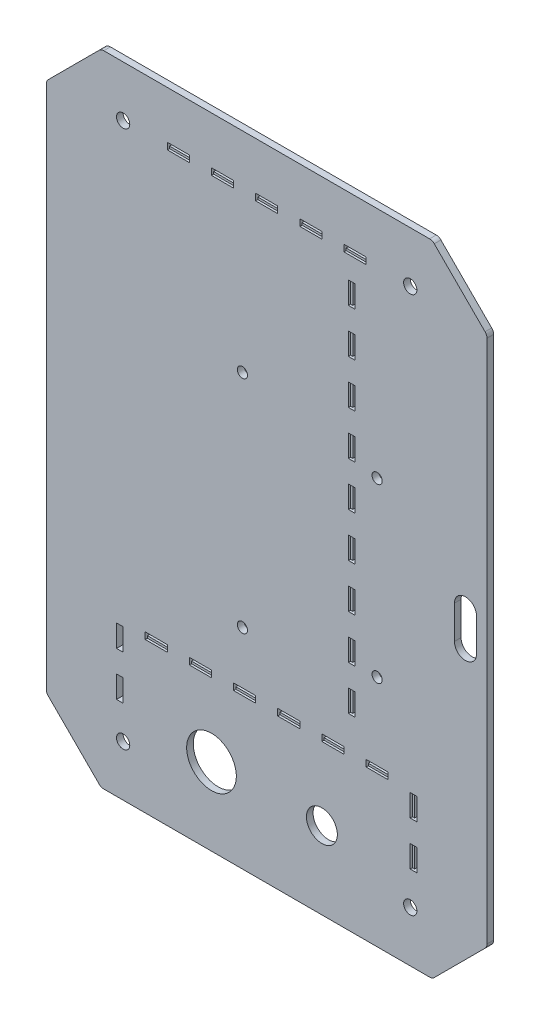
from build123d import *

# Parameters (mm, degrees)
BASE_DEPTH                             = 3
ESQUISSE2_R                            = 3
PER_AGE_PROFIL_DEPTH                   = 5
ESQUISSE3_R                            = 2.3
PER_AGE_LIDAR_DEPTH                    = 176.815265444
ESQUISSE4_R                            = 11.25
PER_AGE_BOUTON_D_ARRET_D_URGENCE_DEPTH = 176.815265444
ESQUISSE5_R                            = 7
PER_AGE_TIRETTE_DEPTH                  = 176.815265444
PER_AGE_CABLE_MANAGEMENT_DEPTH         = 176.815265444
SKETCH1_W                              = 10
SKETCH1_H                              = 3
SKETCH1_W_2                            = 3
SKETCH1_H_2                            = 10
CUT_EXTRUDE1_DEPTH                     = 176.815265444
CONG_1_R                               = 3
ESQUISSE10_W                           = 90
ESQUISSE10_H                           = 1
ESQUISSE10_W_2                         = 1
ESQUISSE10_H_2                         = 170
ESQUISSE10_W_3                         = 110
ESQUISSE10_H_3                         = 30
BOSS_EXTRU_1_DEPTH                     = 2


with BuildPart() as part:
    # Esquisse1 → Base (new body)
    with BuildSketch(Plane.XY):
        Polygon((-99.748737342, 120), (-75, 144.748737342), (75, 144.748737342), (99.748737342, 120), (99.748737342, -120), (75, -144.748737342), (-75, -144.748737342), (-99.748737342, -120), align=None)
    extrude(amount=BASE_DEPTH)

    # Esquisse2 → Perçage profilé (cut)
    with BuildSketch(Plane.XY.offset(3)):
        with Locations((-65, 121.748737342)):
            Circle(ESQUISSE2_R)
        with Locations((65, 121.748737342)):
            Circle(ESQUISSE2_R)
        with Locations((65, -121.748737342)):
            Circle(ESQUISSE2_R)
        with Locations((-65, -121.748737342)):
            Circle(ESQUISSE2_R)
    extrude(amount=-PER_AGE_PROFIL_DEPTH, mode=Mode.SUBTRACT)

    # Esquisse3 → Perçage Lidar (cut, through all)
    with BuildSketch(Plane(origin=(0, 0, 0), x_dir=(-1, 0, 0), z_dir=(0, 0, -1))):
        with Locations((-50, 39)):
            Circle(ESQUISSE3_R)
        with Locations((11, 50)):
            Circle(ESQUISSE3_R)
        with Locations((-50, -39)):
            Circle(ESQUISSE3_R)
        with Locations((11, -50)):
            Circle(ESQUISSE3_R)
    extrude(amount=-PER_AGE_LIDAR_DEPTH, mode=Mode.SUBTRACT)

    # Esquisse4 → Perçage bouton d'arret d'urgence (cut, through all)
    with BuildSketch(Plane(origin=(0, 0, 0), x_dir=(-1, 0, 0), z_dir=(0, 0, -1))):
        with Locations((25, -109.748737342)):
            Circle(ESQUISSE4_R)
    extrude(amount=-PER_AGE_BOUTON_D_ARRET_D_URGENCE_DEPTH, mode=Mode.SUBTRACT)

    # Esquisse5 → Perçage tirette (cut, through all)
    with BuildSketch(Plane(origin=(0, 0, 0), x_dir=(-1, 0, 0), z_dir=(0, 0, -1))):
        with Locations((-25, -109.748737342)):
            Circle(ESQUISSE5_R)
    extrude(amount=-PER_AGE_TIRETTE_DEPTH, mode=Mode.SUBTRACT)

    # Esquisse7 → Perçage cable management (cut, through all)
    with BuildSketch(Plane(origin=(0, 0, 0), x_dir=(-1, 0, 0), z_dir=(0, 0, -1))):
        with BuildLine():
            Line((-85, 7.5), (-85, -7.5))
            ThreePointArc((-85, -7.5), (-90, -12.5), (-95, -7.5))
            Line((-95, -7.5), (-95, 7.5))
            ThreePointArc((-95, 7.5), (-90, 12.5), (-85, 7.5))
        make_face()
    extrude(amount=-PER_AGE_CABLE_MANAGEMENT_DEPTH, mode=Mode.SUBTRACT)

    # Sketch1 → Cut-Extrude1 (cut, through all)
    with BuildSketch(Plane(origin=(0, 0, 0), x_dir=(-1, 0, 0), z_dir=(0, 0, -1))):
        with Locations((-40, 121.748737342)):
            Rectangle(SKETCH1_W, SKETCH1_H)
        with Locations((-20, 121.748737342)):
            Rectangle(SKETCH1_W, SKETCH1_H)
        with Locations((0, 121.748737342)):
            Rectangle(SKETCH1_W, SKETCH1_H)
        with Locations((20, 121.748737342)):
            Rectangle(SKETCH1_W, SKETCH1_H)
        with Locations((40, 121.748737342)):
            Rectangle(SKETCH1_W, SKETCH1_H)
        with Locations((-66.5, -101.748737342)):
            Rectangle(SKETCH1_W_2, SKETCH1_H_2)
        with Locations((-38.5, 85.248737342)):
            Rectangle(SKETCH1_W_2, SKETCH1_H_2)
        with Locations((-38.5, 105.248737342)):
            Rectangle(SKETCH1_W_2, SKETCH1_H_2)
        with Locations((-66.5, -81.748737342)):
            Rectangle(SKETCH1_W_2, SKETCH1_H_2)
        with Locations((66.5, -81.748737342)):
            Rectangle(SKETCH1_W_2, SKETCH1_H_2)
        with Locations((66.5, -101.748737342)):
            Rectangle(SKETCH1_W_2, SKETCH1_H_2)
        with Locations((-30, -75.248737342)):
            Rectangle(SKETCH1_W, SKETCH1_H)
        with Locations((-50, -75.248737342)):
            Rectangle(SKETCH1_W, SKETCH1_H)
        with Locations((-10, -75.248737342)):
            Rectangle(SKETCH1_W, SKETCH1_H)
        with Locations((10, -75.248737342)):
            Rectangle(SKETCH1_W, SKETCH1_H)
        with Locations((30, -75.248737342)):
            Rectangle(SKETCH1_W, SKETCH1_H)
        with Locations((50, -75.248737342)):
            Rectangle(SKETCH1_W, SKETCH1_H)
        with Locations((-38.5, 65.248737342)):
            Rectangle(SKETCH1_W_2, SKETCH1_H_2)
        with Locations((-38.5, 45.248737342)):
            Rectangle(SKETCH1_W_2, SKETCH1_H_2)
        with Locations((-38.5, 25.248737342)):
            Rectangle(SKETCH1_W_2, SKETCH1_H_2)
        with Locations((-38.5, 5.248737342)):
            Rectangle(SKETCH1_W_2, SKETCH1_H_2)
        with Locations((-38.5, -14.751262658)):
            Rectangle(SKETCH1_W_2, SKETCH1_H_2)
        with Locations((-38.5, -34.751262658)):
            Rectangle(SKETCH1_W_2, SKETCH1_H_2)
        with Locations((-38.5, -54.751262658)):
            Rectangle(SKETCH1_W_2, SKETCH1_H_2)
    extrude(amount=-CUT_EXTRUDE1_DEPTH, mode=Mode.SUBTRACT)

    # Congé1
    cong_1_edges = [part.edges().sort_by_distance(p)[0] for p in [
        (99.748737342, -120, 1.5),
        (75, -144.748737342, 1.5),
        (-75, -144.748737342, 1.5),
        (-99.748737342, -120, 1.5),
        (-99.748737342, 120, 1.5),
        (-75, 144.748737342, 1.5),
        (99.748737342, 120, 1.5),
        (75, 144.748737342, 1.5),
    ]]
    fillet(cong_1_edges, radius=CONG_1_R)

    # Esquisse10 → Boss.-Extru.1 (add)
    with BuildSketch(Plane(origin=(0, 0, 0), x_dir=(-1, 0, 0), z_dir=(0, 0, -1))):
        with Locations((0, 120.748737342)):
            Rectangle(ESQUISSE10_W, ESQUISSE10_H)
        with Locations((-37.5, 25.248737342)):
            Rectangle(ESQUISSE10_W_2, ESQUISSE10_H_2)
        with Locations((0, -76.248737342)):
            Rectangle(ESQUISSE10_W_3, ESQUISSE10_H)
        with Locations((65.5, -91.748737342)):
            Rectangle(ESQUISSE10_W_2, ESQUISSE10_H_3)
        with Locations((-65.5, -91.748737342)):
            Rectangle(ESQUISSE10_W_2, ESQUISSE10_H_3)
    extrude(amount=-BOSS_EXTRU_1_DEPTH)


solid = part.part
